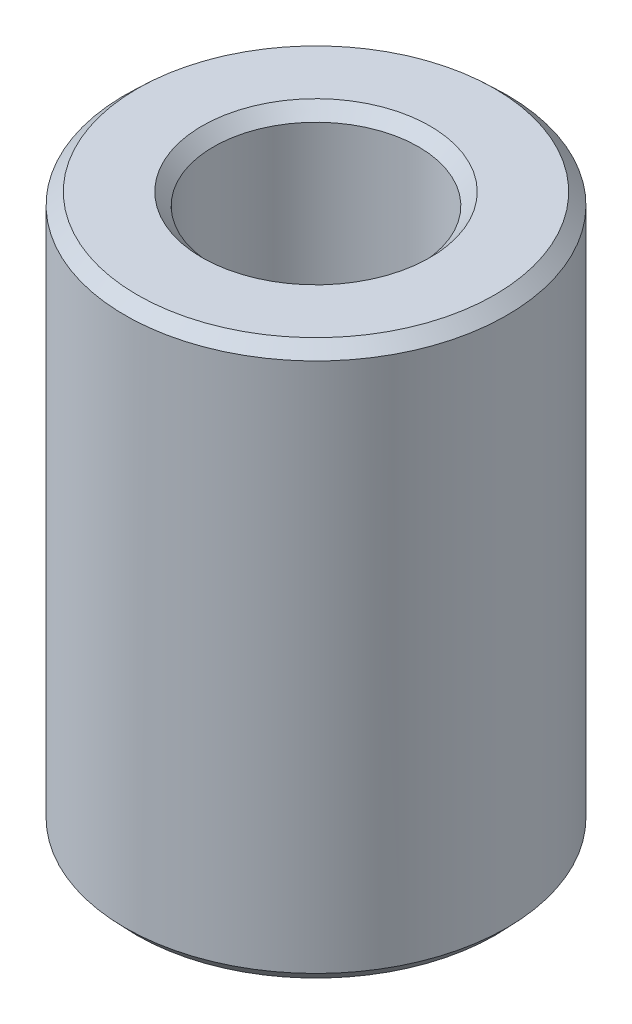
from build123d import *
from OCP.BRepFilletAPI import BRepFilletAPI_MakeChamfer

# Parameters (mm, degrees)
SKETCH1_R           = 55
BOSS_EXTRUDE1_DEPTH = 159.677422282
SKETCH2_R           = 29.519497883
CUT_EXTRUDE1_DEPTH  = 178.614411539
CHAMFER1_SIZE       = 3.332980568
CHAMFER1_SIZE2      = 3.515611706


with BuildPart() as part:
    # Sketch1 → Boss-Extrude1 (new body)
    with BuildSketch(Plane(origin=(0, 0, 0), x_dir=(1, 0, 0), z_dir=(0, 1, 0))):
        Circle(SKETCH1_R)
    extrude(amount=BOSS_EXTRUDE1_DEPTH)

    # Sketch2 → Cut-Extrude1 (cut, through all)
    with BuildSketch(Plane(origin=(0, 0, 0), x_dir=(1, 0, 0), z_dir=(0, 1, 0))):
        Circle(SKETCH2_R)
    extrude(amount=CUT_EXTRUDE1_DEPTH, mode=Mode.SUBTRACT)

    # Chamfer1: one chamfer whose edges measure the first distance from different faces: ONE call of the kernel's chamfer builder (chamfer() names one face for all edges)
    chamfer1_edges_1 = [part.edges().sort_by_distance(p)[0] for p in [
        (-29.519497883, 159.677422282, 0),
    ]]
    chamfer1_side_1 = [part.faces().sort_by_distance(p)[0] for p in [
        (-53.444365081, 159.677422282, 0),
    ]]
    chamfer1_edges_2 = [part.edges().sort_by_distance(p)[0] for p in [
        (-29.519497883, 0, 0),
    ]]
    chamfer1_side_2 = [part.faces().sort_by_distance(p)[0] for p in [
        (-29.519497883, 79.838711141, 0),
    ]]
    chamfer1_edges_3 = [part.edges().sort_by_distance(p)[0] for p in [
        (-55, 0, 0),
    ]]
    chamfer1_side_3 = [part.faces().sort_by_distance(p)[0] for p in [
        (-53.444365081, 0, 0),
    ]]
    chamfer1_edges_4 = [part.edges().sort_by_distance(p)[0] for p in [
        (-55, 159.677422282, 0),
    ]]
    chamfer1_side_4 = [part.faces().sort_by_distance(p)[0] for p in [
        (-55, 79.838711141, 0),
    ]]
    chamfer1 = BRepFilletAPI_MakeChamfer(part.part.solid().wrapped)
    for e in chamfer1_edges_1:
        chamfer1.Add(CHAMFER1_SIZE, CHAMFER1_SIZE2, e.wrapped, chamfer1_side_1[0].wrapped)  # the first distance lies on this face
    for e in chamfer1_edges_2:
        chamfer1.Add(CHAMFER1_SIZE, CHAMFER1_SIZE2, e.wrapped, chamfer1_side_2[0].wrapped)  # the first distance lies on this face
    for e in chamfer1_edges_3:
        chamfer1.Add(CHAMFER1_SIZE, CHAMFER1_SIZE2, e.wrapped, chamfer1_side_3[0].wrapped)  # the first distance lies on this face
    for e in chamfer1_edges_4:
        chamfer1.Add(CHAMFER1_SIZE, CHAMFER1_SIZE2, e.wrapped, chamfer1_side_4[0].wrapped)  # the first distance lies on this face
    add(Compound.cast(chamfer1.Shape()), mode=Mode.REPLACE)


solid = part.part
